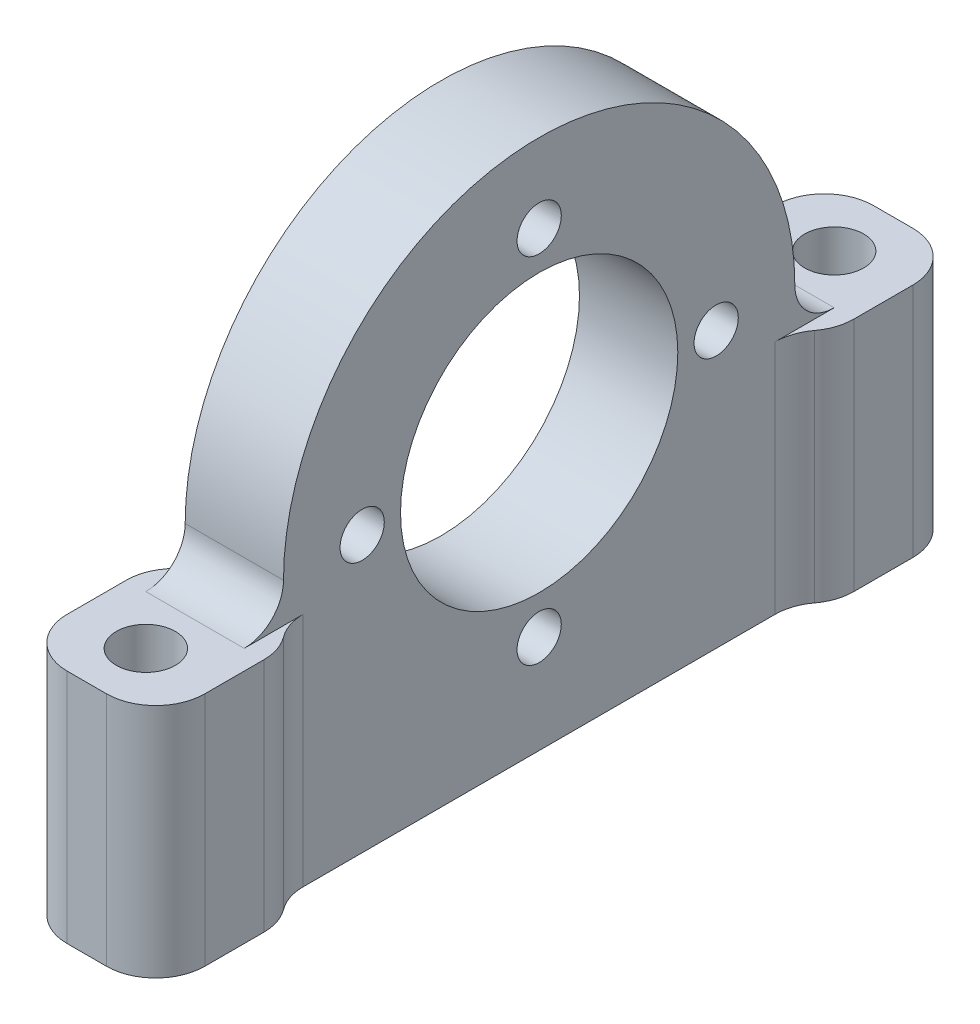
from build123d import *

# Parameters (mm, degrees)
BOSS_EXTRUDE1_DEPTH      = 2.5
BOSS_EXTRUDE1_DEPTH_BACK = 2.5
SKETCH1_R                = 1.125
SKETCH1_R_2              = 7.05
SKETCH2_W                = 7.5
SKETCH2_H                = 12
BOSS_EXTRUDE2_DEPTH      = 3.5
FILLET3_R                = 2.5
FILLET4_R                = 2.5
FILLET5_R                = 2.5
SKETCH5_R                = 1.5
CUT_EXTRUDE1_DEPTH       = 26.64176281
FILLET3_OF_MIRROR1_R     = 2.5
FILLET4_OF_MIRROR1_R     = 2.5
FILLET5_OF_MIRROR1_R     = 2.5
FILLET6_R                = 2


# Some blends are built 0.0001 mm under size
with BuildPart() as part:
    # Sketch1 → Boss-Extrude1 (new, two sides: drawn at the far end of the back side and taken through both)
    with BuildSketch(Plane(origin=(0, 0, 0), x_dir=(0, 0, -1), z_dir=(1, 0, 0)).offset(-BOSS_EXTRUDE1_DEPTH_BACK)):
        with BuildLine():
            Line((-13, 0), (-13, -3))
            Line((-13, -3), (-13, -14))
            Line((-13, -14), (13, -14))
            Line((13, -14), (13, -3))
            Line((13, -3), (13, 0))
            ThreePointArc((13, 0), (0, 13), (-13, 0))
        make_face()
        with Locations((0, 9)):
            Circle(SKETCH1_R, mode=Mode.SUBTRACT)
        with Locations((9, 0)):
            Circle(SKETCH1_R, mode=Mode.SUBTRACT)
        with Locations((0, -9)):
            Circle(SKETCH1_R, mode=Mode.SUBTRACT)
        with Locations((-9, 0)):
            Circle(SKETCH1_R, mode=Mode.SUBTRACT)
        Circle(SKETCH1_R_2, mode=Mode.SUBTRACT)
    extrude(amount=BOSS_EXTRUDE1_DEPTH + BOSS_EXTRUDE1_DEPTH_BACK)

    # Sketch2 → Boss-Extrude2 (add, symmetric)
    with BuildSketch(Plane(origin=(0, 0, 0), x_dir=(0, 0, -1), z_dir=(1, 0, 0))):
        with Locations((-16.75, -8)):
            Rectangle(SKETCH2_W, SKETCH2_H)
    boss_extrude2 = extrude(amount=BOSS_EXTRUDE2_DEPTH, both=True)

    # Fillet3
    fillet3_edges = [part.edges().sort_by_distance(p)[0] for p in [
        (-3.5, -8, 20.5),
        (3.5, -8, 20.5),
    ]]
    fillet(fillet3_edges, radius=FILLET3_R)

    # Fillet4
    # the kernel refuses this fillet: 2.5 mm, written as the material it takes off along each edge
    with BuildSketch(Plane(origin=(-3.5, 3, 13), x_dir=(0, 0, 1), z_dir=(0, -1, 0))) as fillet4_piece_1:
        with BuildLine():
            CenterArc((2, -2.5), FILLET4_R, 90, 53.130102354)
            Line((0, -1), (-0.04, -0.97))
            ThreePointArc((-0.04, -0.97), (-0.05, -0.5), (-0.05, 0))
            Line((-0.05, 0), (0, 0.05))
            Line((0, 0.05), (2, 0.05))
            Line((2, 0.05), (2, 0))
        make_face()
    extrude(amount=22, mode=Mode.SUBTRACT)
    with BuildSketch(Plane(origin=(3.5, 3, 13), x_dir=(-1, 0, 0), z_dir=(0, -1, 0))) as fillet4_piece_2:
        with BuildLine():
            CenterArc((2.5, -2), FILLET4_R, 126.869897646, 53.130102354)
            Line((0, -2), (-0.05, -2))
            Line((-0.05, -2), (-0.05, 0))
            Line((-0.05, 0), (0, 0.05))
            ThreePointArc((0, 0.05), (0.5, 0.05), (0.97, 0.04))
            Line((0.97, 0.04), (1, 0))
        make_face()
    extrude(amount=22, mode=Mode.SUBTRACT)

    # Fillet5
    fillet5_edges = [part.edges().sort_by_distance(p)[0] for p in [
        (2.5, -8, 13),
        (-2.5, -8, 13),
    ]]
    fillet(fillet5_edges, radius=FILLET5_R)

    # Sketch5 → Cut-Extrude1 (cut, symmetric)
    with BuildSketch(Plane(origin=(0, -2, 0), x_dir=(1, 0, 0), z_dir=(0, 1, 0))):
        with Locations(Location((0, -17.5, 0), (0, 0, 270))):
            Circle(SKETCH5_R)
    cut_extrude1 = extrude(amount=CUT_EXTRUDE1_DEPTH, both=True, mode=Mode.SUBTRACT)

    # Mirror1: Boss-Extrude2, Cut-Extrude1 across plane
    add(boss_extrude2.mirror(Plane.XY))
    add(cut_extrude1.mirror(Plane.XY), mode=Mode.SUBTRACT)

    # Fillet3 of Mirror1
    fillet3_of_mirror1_edges = [part.edges().sort_by_distance(p)[0] for p in [
        (-3.5, -8, -20.5),
        (3.5, -8, -20.5),
    ]]
    fillet(fillet3_of_mirror1_edges, radius=FILLET3_OF_MIRROR1_R)

    # Fillet4 of Mirror1
    # the kernel refuses this fillet: 2.5 mm, written as the material it takes off along each edge
    with BuildSketch(Plane(origin=(-3.5, 3, -13), x_dir=(0, 0, -1), z_dir=(0, -1, 0))) as fillet4_of_mirror1_piece_1:
        with BuildLine():
            CenterArc((2, 2.5), FILLET4_OF_MIRROR1_R, 216.869897646, 53.130102354)
            Line((0, 1), (-0.04, 0.97))
            ThreePointArc((-0.04, 0.97), (-0.05, 0.5), (-0.05, 0))
            Line((-0.05, 0), (0, -0.05))
            Line((0, -0.05), (2, -0.05))
            Line((2, -0.05), (2, 0))
        make_face()
    extrude(amount=22, mode=Mode.SUBTRACT)
    with BuildSketch(Plane(origin=(3.5, 3, -13), x_dir=(0, 0, -1), z_dir=(0, -1, 0))) as fillet4_of_mirror1_piece_2:
        with BuildLine():
            CenterArc((2, -2.5), FILLET4_OF_MIRROR1_R, 90, 53.130102354)
            Line((0, -1), (-0.04, -0.97))
            ThreePointArc((-0.04, -0.97), (-0.05, -0.5), (-0.05, 0))
            Line((-0.05, 0), (0, 0.05))
            Line((0, 0.05), (2, 0.05))
            Line((2, 0.05), (2, 0))
        make_face()
    extrude(amount=22, mode=Mode.SUBTRACT)

    # Fillet5 of Mirror1
    fillet5_of_mirror1_edges = [part.edges().sort_by_distance(p)[0] for p in [
        (2.5, -8, -13),
        (-2.5, -8, -13),
    ]]
    fillet(fillet5_of_mirror1_edges, radius=FILLET5_OF_MIRROR1_R)

    # Fillet6
    fillet6_edges = [part.edges().sort_by_distance(p)[0] for p in [
        (0, -2, 13),
        (0, -2, -13),
    ]]
    fillet(fillet6_edges, radius=FILLET6_R - 0.0001)  # a hair under: the kernel refuses the full size


solid = part.part
